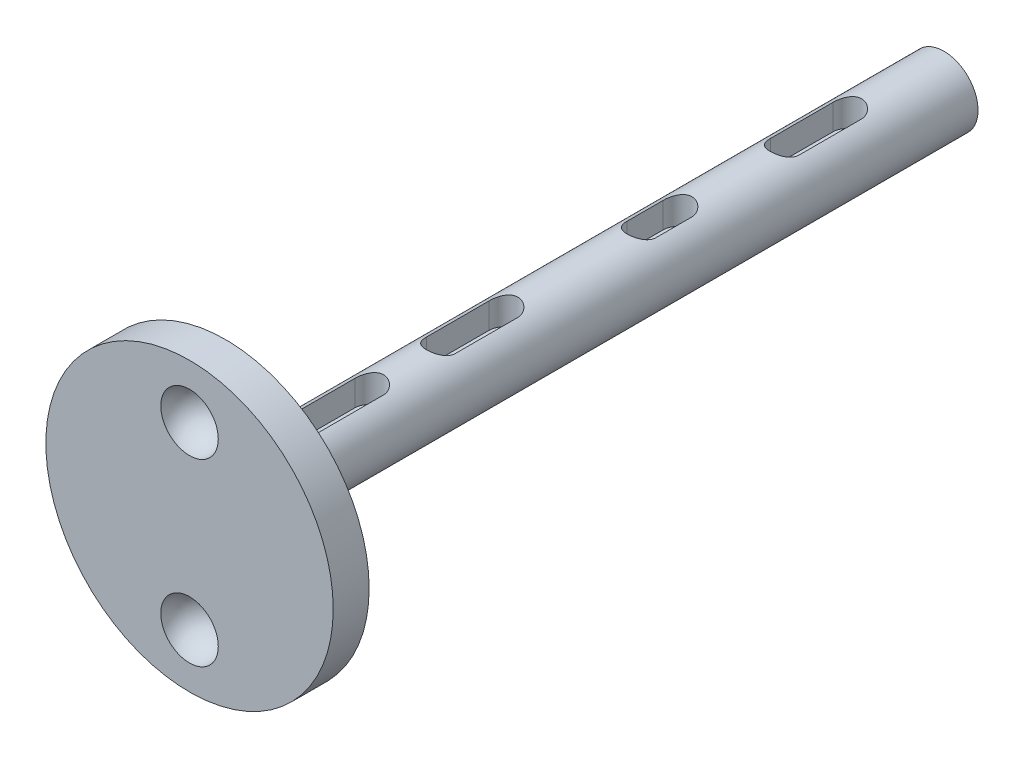
from build123d import *

# Parameters (mm, degrees)
SKETCH1_R           = 20
BOSS_EXTRUDE1_DEPTH = 5
SKETCH3_R           = 4
CUT_EXTRUDE2_DEPTH  = 4
FILLET2_R           = 4
SKETCH4_R           = 4.75
BOSS_EXTRUDE2_DEPTH = 105
CUT_EXTRUDE3_DEPTH  = 4
CUT_EXTRUDE4_START  = -5
SKETCH6_R           = 4.75
CUT_EXTRUDE4_DEPTH  = 5


with BuildPart() as part:
    # Sketch1 → Boss-Extrude1 (new body)
    with BuildSketch(Plane.XY):
        Circle(SKETCH1_R)
    extrude(amount=BOSS_EXTRUDE1_DEPTH)

    # Sketch3 → Cut-Extrude2 (cut)
    with BuildSketch(Plane.XY.offset(5)):
        with Locations((0, 12.5)):
            Circle(SKETCH3_R)
        with Locations((0, -12.5)):
            Circle(SKETCH3_R)
    extrude(amount=-CUT_EXTRUDE2_DEPTH, mode=Mode.SUBTRACT)

    # Fillet2
    fillet2_edges = [part.edges().sort_by_distance(p)[0] for p in [
        (-4, 12.5, 1),
        (-4, -12.5, 1),
    ]]
    fillet(fillet2_edges, radius=FILLET2_R - 0.0001)  # a hair under: the kernel refuses the full size

    # Sketch4 → Boss-Extrude2 (add)
    with BuildSketch(Plane(origin=(0, 0, 0), x_dir=(-1, 0, 0), z_dir=(0, 0, -1))):
        Circle(SKETCH4_R)
    extrude(amount=BOSS_EXTRUDE2_DEPTH)

    # Sketch5 → Cut-Extrude3 (cut)
    with BuildSketch(Plane(origin=(0, 4.75, 0), x_dir=(1, 0, 0), z_dir=(0, 1, 0))):
        with BuildLine():
            Line((-2, 10), (-2, 20))
            ThreePointArc((-2, 20), (0, 22), (2, 20))
            Line((2, 20), (2, 10))
            ThreePointArc((2, 10), (0, 8), (-2, 10))
        make_face()
        with BuildLine():
            Line((-2, 30), (-2, 38.71))
            ThreePointArc((-2, 38.71), (0, 40.71), (2, 38.71))
            Line((2, 38.71), (2, 30))
            ThreePointArc((2, 30), (0, 28), (-2, 30))
        make_face()
        with BuildLine():
            Line((-2, 77.83), (-2, 86.54))
            ThreePointArc((-2, 86.54), (0, 88.54), (2, 86.54))
            Line((2, 86.54), (2, 77.83))
            ThreePointArc((2, 77.83), (0, 75.83), (-2, 77.83))
        make_face()
        with BuildLine():
            Line((-2, 57.92), (-2, 62.92))
            ThreePointArc((-2, 62.92), (0, 64.92), (2, 62.92))
            Line((2, 62.92), (2, 57.92))
            ThreePointArc((2, 57.92), (0, 55.92), (-2, 57.92))
        make_face()
    extrude(amount=-CUT_EXTRUDE3_DEPTH, mode=Mode.SUBTRACT)

    # Sketch6 → Cut-Extrude4 (cut)
    with BuildSketch(Plane(origin=(0, 0, -105), x_dir=(-1, 0, 0), z_dir=(0, 0, -1)).offset(CUT_EXTRUDE4_START)):
        Circle(SKETCH6_R)
    extrude(amount=CUT_EXTRUDE4_DEPTH, mode=Mode.SUBTRACT)


solid = part.part
